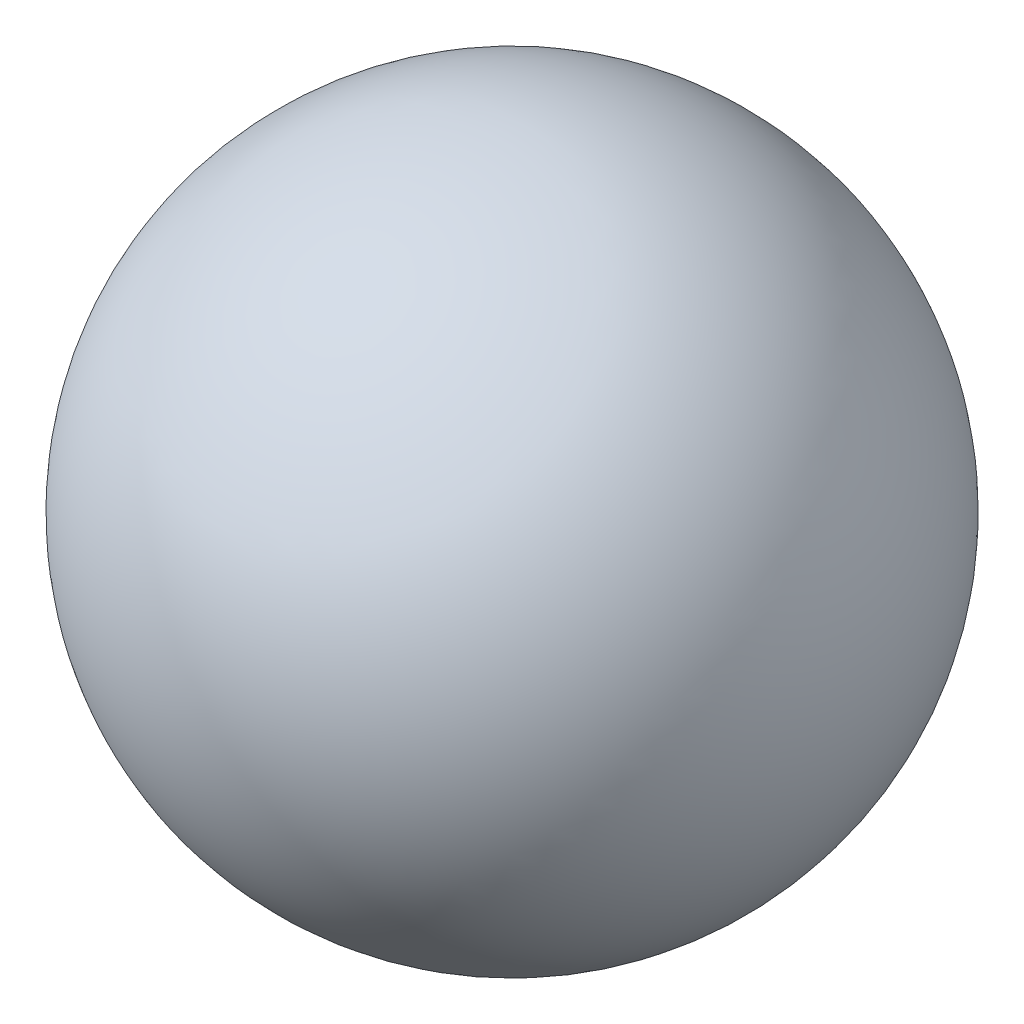
from build123d import *

# Parameters (mm, degrees)
BOSS_EXTRUDE1_DEPTH = 35
SKETCH5_W           = 110
SKETCH5_H           = 110
BOSS_EXTRUDE2_DEPTH = 55
BOSS_EXTRUDE3_DEPTH = 10
FILLET1_R           = 20
FILLET4_R           = 10


with BuildPart() as part:
    # Sketch4 → Boss-Extrude1 (new body)
    with BuildSketch(Plane.XY.offset(90)):
        with BuildLine():
            ThreePointArc((18, 0), (12.727922061, 12.727922061), (0, 18))
            Line((0, 18), (-40, 18))
            Line((-40, 18), (-40, 0))
            Line((-40, 0), (-5, 0))
            ThreePointArc((-5, 0), (0, 5), (5, 0))
            Line((5, 0), (18, 0))
        make_face()
        with BuildLine():
            ThreePointArc((0, -18), (12.727922061, -12.727922061), (18, 0))
            Line((18, 0), (5, 0))
            ThreePointArc((5, 0), (0, -5), (-5, 0))
            Line((-5, 0), (-40, 0))
            Line((-40, 0), (-40, -18))
            Line((-40, -18), (0, -18))
        make_face()
    extrude(amount=-BOSS_EXTRUDE1_DEPTH)

    # Sketch5 → Boss-Extrude2 (add)
    with BuildSketch(Plane(origin=(0, 0, 55), x_dir=(-1, 0, 0), z_dir=(0, 0, -1))):
        with Locations((22, 0)):
            Rectangle(SKETCH5_W, SKETCH5_H)
    extrude(amount=BOSS_EXTRUDE2_DEPTH)

    # Sketch7 → Boss-Extrude3 (add)
    with BuildSketch(Plane(origin=(0, 0, 0), x_dir=(-1, 0, 0), z_dir=(0, 0, -1))):
        Polygon((87, -65), (125, -79.925557452), (125, 79.925557452), (87, 65), (-43, 65), (-43, -65), align=None)
    extrude(amount=-BOSS_EXTRUDE3_DEPTH)

    # Fillet1
    fillet1_edges = [part.edges().sort_by_distance(p)[0] for p in [
        (-125, -79.925557452, 5),
        (-87, -65, 5),
        (43, -65, 5),
        (43, 65, 5),
        (-87, 65, 5),
        (-125, 79.925557452, 5),
    ]]
    fillet(fillet1_edges, radius=FILLET1_R)

    # Fillet4
    fillet4_edges = [part.edges().sort_by_distance(p)[0] for p in [
        (-40, -18, 72.5),
        (-40, 18, 72.5),
        (33, 0, 55),
        (-22, -55, 55),
        (-77, 0, 55),
        (-22, 55, 55),
        (33, -55, 32.5),
        (33, 55, 32.5),
        (33, 0, 10),
        (-77, -55, 32.5),
        (-77, 55, 32.5),
        (-77, 0, 10),
        (-22, 55, 10),
        (-22, -55, 10),
    ]]
    fillet(fillet4_edges, radius=FILLET4_R - 0.0001)  # a hair under: the kernel refuses the full size


with BuildPart() as body_2:
    # Sketch8 → Revolve1 (revolve)
    with BuildSketch(Plane(origin=(0, 0, 0), x_dir=(1, 0, 0), z_dir=(0, 1, 0))):
        with BuildLine():
            Line((0, -474), (0, 204))
            ThreePointArc((0, 204), (339, -135), (0, -474))
        make_face()
    revolve(axis=Axis((0, 0, 474), (0, 0, -1)))


solid = Compound([part.part, body_2.part])
